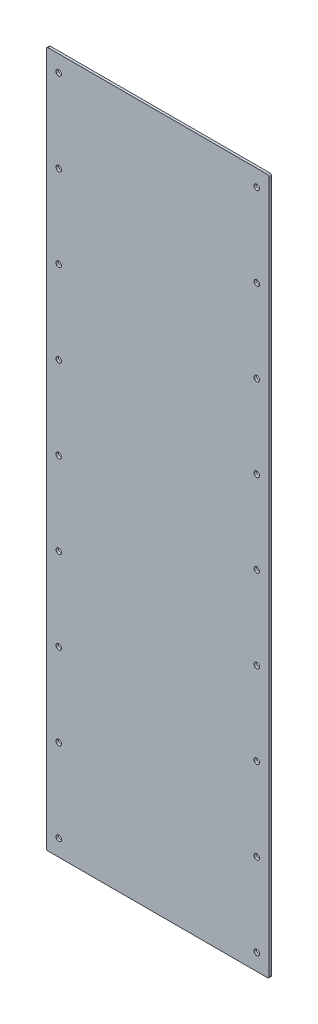
from build123d import *

# Parameters (mm, degrees)
SKETCH1_W          = 270
SKETCH1_H          = 843
BASE_FLANGE1_DEPTH = 3
CRVPATTERN2_COUNT  = 9
CRVPATTERN2_PITCH  = 100.375
FILLET1_R          = 2


# Sheet-metal steps are written as plain solids
with BuildPart() as part:
    # Sketch1 → Base-Flange1 (new body)
    with BuildSketch(Plane.XY):
        with Locations((0, 421.5)):
            Rectangle(SKETCH1_W, SKETCH1_H)
    extrude(amount=-BASE_FLANGE1_DEPTH)

    # Sketch8 → M6 Clearance Hole1 (revolve, cut)
    with BuildSketch(Plane(origin=(-120, 20, 0), x_dir=(0, -1, 0), z_dir=(1, 0, 0))):
        Polygon((0, 0), (0, 3), (3.3, 3), (3.3, 0.025), (3.325, 0), align=None)
    m6_clearance_hole1 = revolve(axis=Axis((-120, 20, 6.35), (0, 0, -1)), mode=Mode.SUBTRACT)

    # CrvPattern2: M6 Clearance Hole1 ×9
    with Locations(*[(0, i * CRVPATTERN2_PITCH, 0) for i in range(1, CRVPATTERN2_COUNT)]):
        add(m6_clearance_hole1, mode=Mode.SUBTRACT)

    # Mirror1: M6 Clearance Hole1 across plane
    add(m6_clearance_hole1.mirror(Plane(origin=(0, 0, 0), x_dir=(0, 0, 1), z_dir=(1, 0, 0))), mode=Mode.SUBTRACT)

    # Mirror1 copy 1 sketch → Mirror1 copy 1 (revolve, cut)
    with BuildSketch(Plane(origin=(120, 120.375, 0), x_dir=(0, -1, 0), z_dir=(-1, 0, 0))):
        Polygon((0, 0), (0, -3), (3.3, -3), (3.3, -0.025), (3.325, 0), align=None)
    revolve(axis=Axis((120, 120.375, 6.35), (0, 0, 1)), mode=Mode.SUBTRACT)

    # Mirror1 copy 2 sketch → Mirror1 copy 2 (revolve, cut)
    with BuildSketch(Plane(origin=(120, 220.75, 0), x_dir=(0, -1, 0), z_dir=(-1, 0, 0))):
        Polygon((0, 0), (0, -3), (3.3, -3), (3.3, -0.025), (3.325, 0), align=None)
    revolve(axis=Axis((120, 220.75, 6.35), (0, 0, 1)), mode=Mode.SUBTRACT)

    # Mirror1 copy 3 sketch → Mirror1 copy 3 (revolve, cut)
    with BuildSketch(Plane(origin=(120, 321.125, 0), x_dir=(0, -1, 0), z_dir=(-1, 0, 0))):
        Polygon((0, 0), (0, -3), (3.3, -3), (3.3, -0.025), (3.325, 0), align=None)
    revolve(axis=Axis((120, 321.125, 6.35), (0, 0, 1)), mode=Mode.SUBTRACT)

    # Mirror1 copy 4 sketch → Mirror1 copy 4 (revolve, cut)
    with BuildSketch(Plane(origin=(120, 421.5, 0), x_dir=(0, -1, 0), z_dir=(-1, 0, 0))):
        Polygon((0, 0), (0, -3), (3.3, -3), (3.3, -0.025), (3.325, 0), align=None)
    revolve(axis=Axis((120, 421.5, 6.35), (0, 0, 1)), mode=Mode.SUBTRACT)

    # Mirror1 copy 5 sketch → Mirror1 copy 5 (revolve, cut)
    with BuildSketch(Plane(origin=(120, 521.875, 0), x_dir=(0, -1, 0), z_dir=(-1, 0, 0))):
        Polygon((0, 0), (0, -3), (3.3, -3), (3.3, -0.025), (3.325, 0), align=None)
    revolve(axis=Axis((120, 521.875, 6.35), (0, 0, 1)), mode=Mode.SUBTRACT)

    # Mirror1 copy 6 sketch → Mirror1 copy 6 (revolve, cut)
    with BuildSketch(Plane(origin=(120, 622.25, 0), x_dir=(0, -1, 0), z_dir=(-1, 0, 0))):
        Polygon((0, 0), (0, -3), (3.3, -3), (3.3, -0.025), (3.325, 0), align=None)
    revolve(axis=Axis((120, 622.25, 6.35), (0, 0, 1)), mode=Mode.SUBTRACT)

    # Mirror1 copy 7 sketch → Mirror1 copy 7 (revolve, cut)
    with BuildSketch(Plane(origin=(120, 722.625, 0), x_dir=(0, -1, 0), z_dir=(-1, 0, 0))):
        Polygon((0, 0), (0, -3), (3.3, -3), (3.3, -0.025), (3.325, 0), align=None)
    revolve(axis=Axis((120, 722.625, 6.35), (0, 0, 1)), mode=Mode.SUBTRACT)

    # Mirror1 copy 8 sketch → Mirror1 copy 8 (revolve, cut)
    with BuildSketch(Plane(origin=(120, 823, 0), x_dir=(0, -1, 0), z_dir=(-1, 0, 0))):
        Polygon((0, 0), (0, -3), (3.3, -3), (3.3, -0.025), (3.325, 0), align=None)
    revolve(axis=Axis((120, 823, 6.35), (0, 0, 1)), mode=Mode.SUBTRACT)

    # Fillet1
    fillet1_edges = [part.edges().sort_by_distance(p)[0] for p in [
        (-135, 843, -1.5),
        (135, 843, -1.5),
        (135, 0, -1.5),
        (-135, 0, -1.5),
    ]]
    fillet(fillet1_edges, radius=FILLET1_R)


solid = part.part
